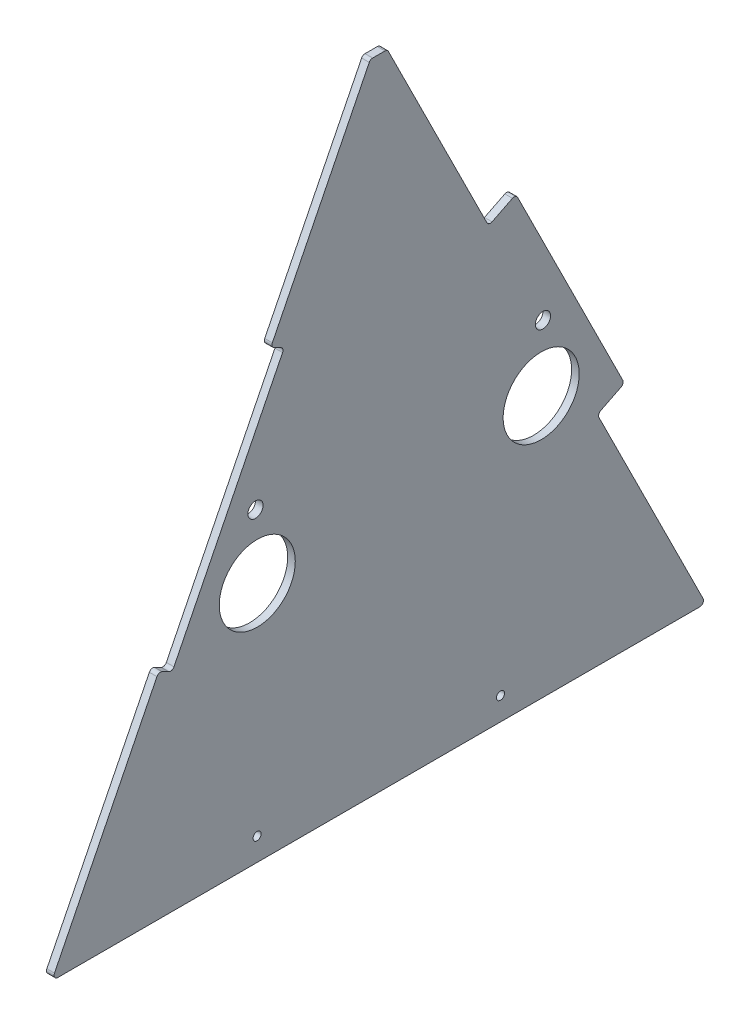
from build123d import *

# Parameters (mm, degrees)
SKETCH1_R           = 3.3734375
SKETCH1_R_2         = 6.35
SKETCH1_R_3         = 31.75
BOSS_EXTRUDE1_DEPTH = 6.35
FILLET1_R           = 3.175


with BuildPart() as part:
    # Sketch1 → Boss-Extrude1 (new body)
    with BuildSketch(Plane(origin=(0, 0, 0), x_dir=(0, 0, -1), z_dir=(1, 0, 0))):
        Polygon((0, 0), (546.1, 0), (455.432604376, 181.850662278), (478.163937161, 193.184086731), (387.496541537, 375.034749008), (364.765208752, 363.701324555), (280.156570264, 533.4), (265.943429736, 533.4), (182.751469304, 366.542741153), (194.117135697, 360.876028927), (100.61638396, 173.342533453), (89.250717567, 179.009245679), align=None)
        with Locations((171.45, 19.05)):
            Circle(SKETCH1_R, mode=Mode.SUBTRACT)
        with Locations((374.65, 19.05)):
            Circle(SKETCH1_R, mode=Mode.SUBTRACT)
        with Locations((410.098906564, 272.775993416)):
            Circle(SKETCH1_R_2, mode=Mode.SUBTRACT)
        with Locations((170.098092613, 255.775856737)):
            Circle(SKETCH1_R_2, mode=Mode.SUBTRACT)
        with Locations((171.579254548, 201.821183313)):
            Circle(SKETCH1_R_3, mode=Mode.SUBTRACT)
        with Locations((408.617744629, 218.821319992)):
            Circle(SKETCH1_R_3, mode=Mode.SUBTRACT)
    extrude(amount=BOSS_EXTRUDE1_DEPTH)

    # Fillet1
    fillet1_edges = [part.edges().sort_by_distance(p)[0] for p in [
        (3.175, 533.4, -280.156570264),
        (3.175, 0, 0),
        (3.175, 179.009245679, -89.250717567),
        (3.175, 173.342533453, -100.61638396),
        (3.175, 360.876028927, -194.117135697),
        (3.175, 366.542741153, -182.751469304),
        (3.175, 533.4, -265.943429736),
        (3.175, 363.701324555, -364.765208752),
        (3.175, 375.034749008, -387.496541537),
        (3.175, 193.184086731, -478.163937161),
        (3.175, 181.850662278, -455.432604376),
        (3.175, 0, -546.1),
    ]]
    fillet(fillet1_edges, radius=FILLET1_R)


solid = part.part
